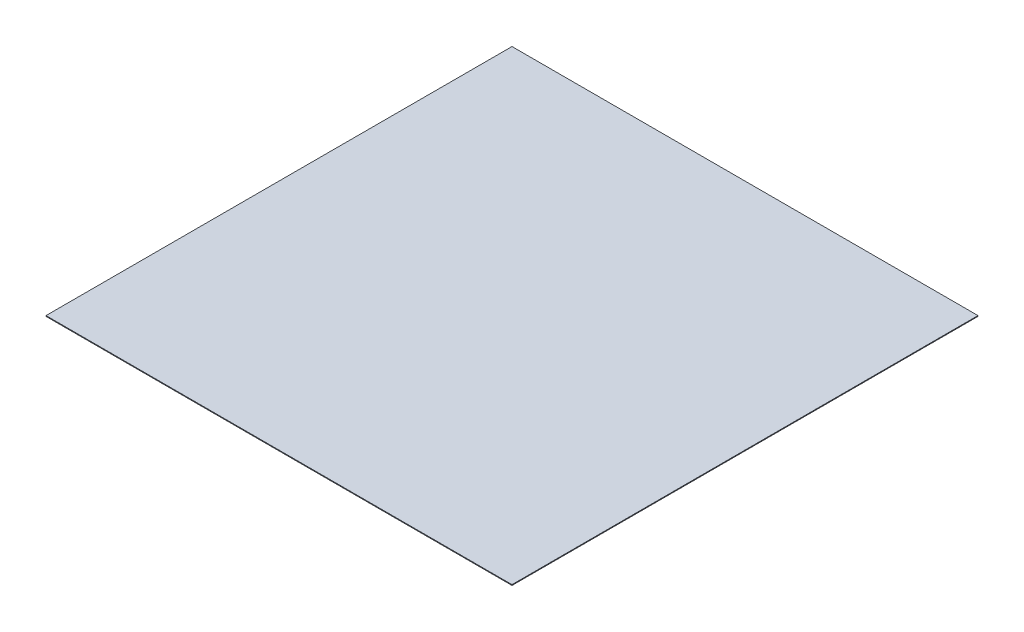
from build123d import *

# Parameters (mm, degrees)
SKETCH1_W           = 2000
SKETCH1_H           = 2000
BOSS_EXTRUDE1_DEPTH = 3.175


with BuildPart() as part:
    # Sketch1 → Boss-Extrude1 (new body)
    with BuildSketch(Plane(origin=(0, 0, 0), x_dir=(1, 0, 0), z_dir=(0, 1, 0))):
        with Locations((1000, -1000)):
            Rectangle(SKETCH1_W, SKETCH1_H)
    extrude(amount=BOSS_EXTRUDE1_DEPTH)


solid = part.part
